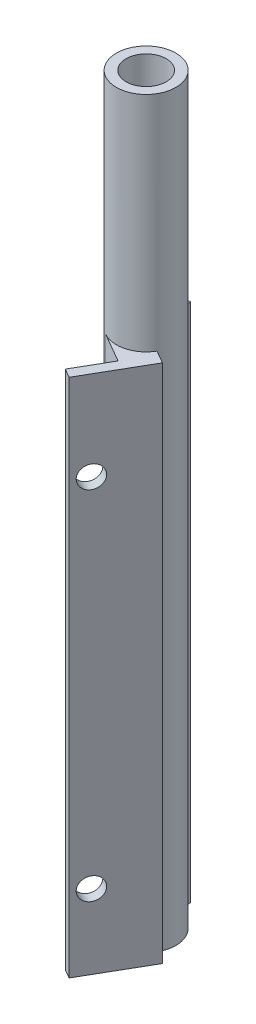
from build123d import *

# Parameters (mm, degrees)
SKETCH1_R           = 5.08
BOSS_EXTRUDE1_DEPTH = 127
SKETCH2_R           = 3.429
CUT_EXTRUDE1_DEPTH  = 128.2030377
BOSS_EXTRUDE2_DEPTH = 88.9
HOLE_CUTS_1_REACH   = 130.439
SKETCH4_R           = 1.905
HOLE_CUTS_2_REACH   = 130.439
SKETCH7_R           = 1.905
CUT_EXTRUDE7_REACH  = 130.439
SKETCH8_W           = 6.604
SKETCH8_H           = 4.572
SKETCH9_W           = 11.684
SKETCH9_H           = 88.9
CUT_EXTRUDE8_DEPTH  = 2.54
SKETCH10_W          = 11.684
SKETCH10_H          = 88.9
CUT_EXTRUDE9_DEPTH  = 2.54
SKETCH11_W          = 6.604
SKETCH11_H          = 88.9
CUT_EXTRUDE10_DEPTH = 1.27
SKETCH13_W          = 6.604
SKETCH13_H          = 88.9
CUT_EXTRUDE11_DEPTH = 1.27


with BuildPart() as part:
    # Sketch1 → Boss-Extrude1 (new body)
    with BuildSketch(Plane(origin=(0, 0, 0), x_dir=(1, 0, 0), z_dir=(0, 1, 0))):
        Circle(SKETCH1_R)
    extrude(amount=BOSS_EXTRUDE1_DEPTH)

    # Sketch2 → Cut-Extrude1 (cut, through all)
    with BuildSketch(Plane.XZ):
        Circle(SKETCH2_R)
    extrude(amount=-CUT_EXTRUDE1_DEPTH, mode=Mode.SUBTRACT)

    # Sketch3 → Boss-Extrude2 (add)
    with BuildSketch(Plane.XZ):
        with BuildLine():
            Line((-1.442590949, 12.658640818), (-5.842, 10.118640818))
            Line((-5.842, 10.118640818), (-2.54, 4.399409051))
            ThreePointArc((-2.54, 4.399409051), (2.96960111, -1.7145), (-5.08, 0))
            Line((-5.08, 0), (-11.684, 0))
            Line((-11.684, 0), (-11.684, -5.08))
            Line((-11.684, -5.08), (-11.684, -10.16))
            Line((-11.684, -10.16), (0, -10.16))
            Line((0, -10.16), (0, -5.08))
            ThreePointArc((0, -5.08), (4.399409051, -2.54), (4.399409051, 2.54))
            Line((4.399409051, 2.54), (8.798818102, 5.08))
            Line((8.798818102, 5.08), (2.956818102, 15.198640818))
            Line((2.956818102, 15.198640818), (-1.442590949, 12.658640818))
        make_face()
    extrude(amount=-BOSS_EXTRUDE2_DEPTH)

    # Sketch4 → Hole Cuts 1 (cut, up to next)
    with BuildSketch(Plane.XY, mode=Mode.PRIVATE) as hole_cuts_1_sk1:
        with Locations((-8.89, 81.28)):
            Circle(SKETCH4_R)
    hole_cuts_1_tool1 = extrude(hole_cuts_1_sk1.sketch, amount=-HOLE_CUTS_1_REACH, mode=Mode.PRIVATE) & part.part
    # Sketch4 → Hole Cuts 1 (cut, up to next)
    with BuildSketch(Plane.XY, mode=Mode.PRIVATE) as hole_cuts_1_sk2:
        with Locations((-8.89, 20.32)):
            Circle(SKETCH4_R)
    hole_cuts_1_tool2 = extrude(hole_cuts_1_sk2.sketch, amount=-HOLE_CUTS_1_REACH, mode=Mode.PRIVATE) & part.part
    add(hole_cuts_1_tool1.solids().sort_by_distance((-8.89, 81.28, 0))[0], mode=Mode.SUBTRACT)
    add(hole_cuts_1_tool2.solids().sort_by_distance((-8.89, 20.32, 0))[0], mode=Mode.SUBTRACT)

    # Sketch7 → Hole Cuts 2 (cut, up to next)
    with BuildSketch(Plane(origin=(0, 0, 0), x_dir=(0.49999999999999784, 0, -0.86602540378444), z_dir=(0.86602540378444, 0, 0.49999999999999784)), mode=Mode.PRIVATE) as hole_cuts_2_sk1:
        with Locations((-8.89, 73.66)):
            Circle(SKETCH7_R)
    hole_cuts_2_tool1 = extrude(hole_cuts_2_sk1.sketch, amount=HOLE_CUTS_2_REACH, mode=Mode.PRIVATE) & part.part
    # Sketch7 → Hole Cuts 2 (cut, up to next)
    with BuildSketch(Plane(origin=(0, 0, 0), x_dir=(0.49999999999999784, 0, -0.86602540378444), z_dir=(0.86602540378444, 0, 0.49999999999999784)), mode=Mode.PRIVATE) as hole_cuts_2_sk2:
        with Locations((-8.89, 12.7)):
            Circle(SKETCH7_R)
    hole_cuts_2_tool2 = extrude(hole_cuts_2_sk2.sketch, amount=HOLE_CUTS_2_REACH, mode=Mode.PRIVATE) & part.part
    add(hole_cuts_2_tool1.solids().sort_by_distance((-4.445, 73.66, 7.698966))[0], mode=Mode.SUBTRACT)
    add(hole_cuts_2_tool2.solids().sort_by_distance((-4.445, 12.7, 7.698966))[0], mode=Mode.SUBTRACT)

    # Sketch8 → Cut-Extrude7 (cut, up to next)
    with BuildSketch(Plane.XZ, mode=Mode.PRIVATE) as cut_extrude7_sk1:
        Polygon((-5.842, 10.118640818), (-1.882531854, 12.404640818), (1.419468146, 6.685409051), (-2.54, 4.399409051), align=None)
    cut_extrude7_tool1 = extrude(cut_extrude7_sk1.sketch, amount=-CUT_EXTRUDE7_REACH, mode=Mode.PRIVATE) & part.part
    # Sketch8 → Cut-Extrude7 (cut, up to next)
    with BuildSketch(Plane.XZ, mode=Mode.PRIVATE) as cut_extrude7_sk2:
        with Locations((-8.382, -2.286)):
            Rectangle(SKETCH8_W, SKETCH8_H)
    cut_extrude7_tool2 = extrude(cut_extrude7_sk2.sketch, amount=-CUT_EXTRUDE7_REACH, mode=Mode.PRIVATE) & part.part
    add(cut_extrude7_tool1.solids().sort_by_distance((-2.211266, 0, 8.402025))[0], mode=Mode.SUBTRACT)
    add(cut_extrude7_tool2.solids().sort_by_distance((-8.382, 0, -2.286))[0], mode=Mode.SUBTRACT)

    # Sketch9 → Cut-Extrude8 (cut)
    with BuildSketch(Plane(origin=(0, 0, -10.16), x_dir=(-1, 0, 0), z_dir=(0, 0, -1))):
        with Locations((5.842, 44.45)):
            Rectangle(SKETCH9_W, SKETCH9_H)
    extrude(amount=-CUT_EXTRUDE8_DEPTH, mode=Mode.SUBTRACT)

    # Sketch10 → Cut-Extrude9 (cut)
    with BuildSketch(Plane(origin=(8.798818102, 0, 5.08), x_dir=(0.4999999999999982, 0, -0.8660254037844397), z_dir=(0.8660254037844398, 0, 0.4999999999999983))):
        with Locations((-5.842, 44.45)):
            Rectangle(SKETCH10_W, SKETCH10_H)
    extrude(amount=-CUT_EXTRUDE9_DEPTH, mode=Mode.SUBTRACT)

    # Sketch11 → Cut-Extrude10 (cut)
    with BuildSketch(Plane.XY.offset(-4.572)):
        with Locations((-8.382, 44.45)):
            Rectangle(SKETCH11_W, SKETCH11_H)
    extrude(amount=-CUT_EXTRUDE10_DEPTH, mode=Mode.SUBTRACT)

    # Sketch13 → Cut-Extrude11 (cut)
    with BuildSketch(Plane(origin=(3.959468146, 0, 2.286), x_dir=(-0.5000000000000004, 0, 0.8660254037844384), z_dir=(-0.8660254037844384, 0, -0.5000000000000004))):
        with Locations((8.382, 44.45)):
            Rectangle(SKETCH13_W, SKETCH13_H)
    extrude(amount=-CUT_EXTRUDE11_DEPTH, mode=Mode.SUBTRACT)


solid = part.part
